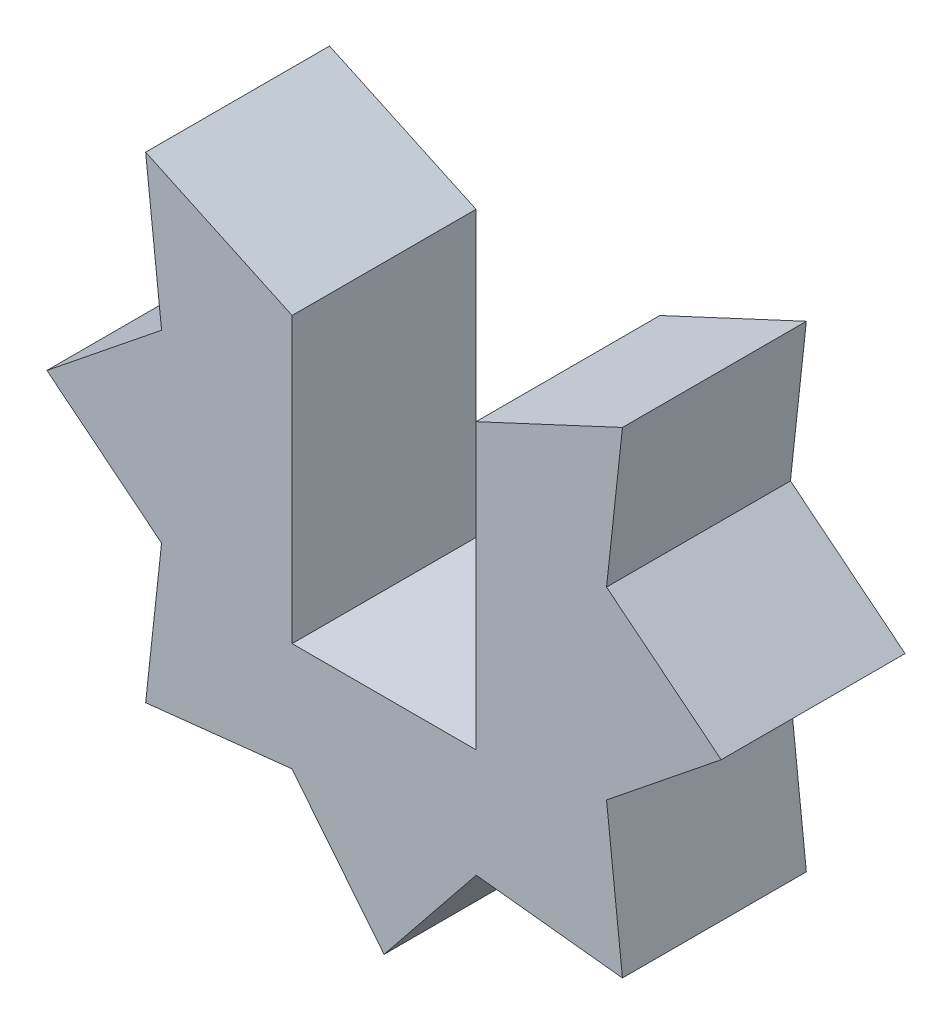
from build123d import *

# Parameters (mm, degrees)
RESSALTO_EXTRUS_O1_DEPTH = 6
ESBO_O2_W                = 6
ESBO_O2_H                = 6
CORTE_EXTRUS_O1_DEPTH    = 10


with BuildPart() as part:
    # Esboço1 → Ressalto-extrusão1 (new body)
    with BuildSketch(Plane.XY):
        Polygon((3, 2.28086846), (-3, 2.28086846), (-3, 5.552723944), (-7.778174593, 7.778174593), (-7.259013875, 3.006781996), (-11, 0), (-7.259060972, -3.006840593), (-7.778167576, -7.778239077), (-3.006781996, -7.259013875), (0, -11), (3.006781996, -7.259013875), (7.778174593, -7.778174593), (7.259013875, -3.006781996), (11, 0), (7.259013875, 3.006781996), (7.778174593, 7.778174593), (3, 5.552723944), align=None)
    extrude(amount=RESSALTO_EXTRUS_O1_DEPTH)

    # Esboço2 → Corte-extrusão1 (cut)
    with BuildSketch(Plane.XY.offset(6)):
        with Locations((0, -0.71913154)):
            Rectangle(ESBO_O2_W, ESBO_O2_H)
    extrude(amount=-CORTE_EXTRUS_O1_DEPTH, mode=Mode.SUBTRACT)


solid = part.part
